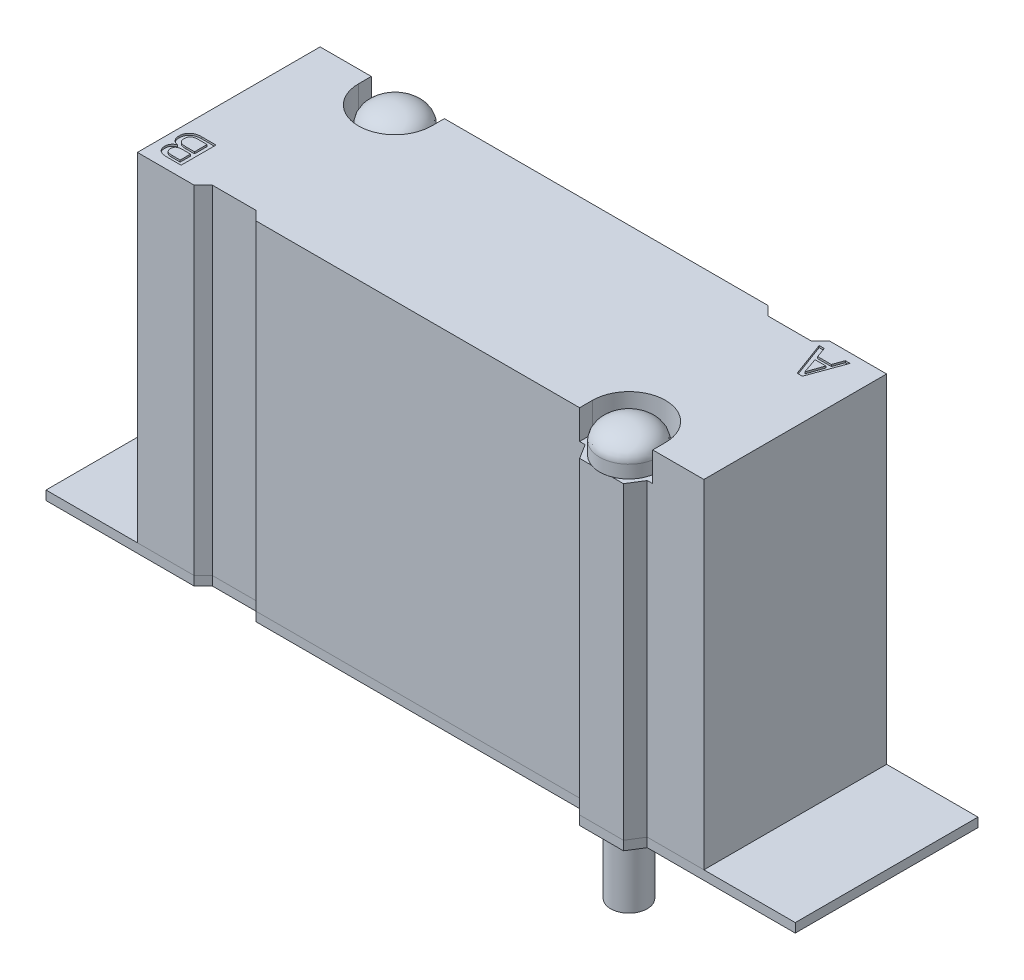
from build123d import *

# Parameters (mm, degrees)
BASE_SKETCH_W                 = 31
BASE_SKETCH_H                 = 11.6
VALVE_BASE_DEPTH              = 18.5
MOUNTING_SKETCH_R             = 1.1
MOUNTING_SCREW_HOLES_DEPTH    = 25.822167512
SIDE_CUTOUTS_DEPTH            = 25.822167512
CUT_EXTRUDE_A_DEPTH           = 0.1
CUT_EXTRUDE_B_DEPTH           = 0.1
SCREW_RELIEF_DEPTH            = 1.6
SCREW_HEAD_SKETCH_R           = 1.6
SCREW_HEAD_DEPTH              = 0.7
SCREW_HEAD_DOME_1_FACE_RADIUS = 1.6
SCREW_HEAD_DOME_1_HEIGHT      = 1
SCREW_HEAD_DOME_2_FACE_RADIUS = 1.6
SCREW_HEAD_DOME_2_HEIGHT      = 1
SCREW_THREADS_SKETCH_R        = 1
SCREW_THREADS_DEPTH           = 21
F_40_GASKET_SKETCH_R          = 1.1
F_40_GASKET_DEPTH             = 0.5


with BuildPart() as part:
    # Base Sketch → Valve base (new body)
    with BuildSketch(Plane(origin=(0, 0, 0), x_dir=(1, 0, 0), z_dir=(0, 1, 0))):
        Rectangle(BASE_SKETCH_W, BASE_SKETCH_H)
    extrude(amount=VALVE_BASE_DEPTH)

    # Mounting Sketch → Mounting Screw holes (cut, through all)
    with BuildSketch(Plane(origin=(0, 18.5, 0), x_dir=(-1, 0, 0), z_dir=(0, 1, 0))):
        with Locations((-10.7, 4.3)):
            Circle(MOUNTING_SKETCH_R)
        with Locations((10.7, -4.3)):
            Circle(MOUNTING_SKETCH_R)
    extrude(amount=-MOUNTING_SCREW_HOLES_DEPTH, mode=Mode.SUBTRACT)

    # side cut sketch → Side cutouts (cut, through all)
    with BuildSketch(Plane(origin=(0, 18.5, 0), x_dir=(-1, 0, 0), z_dir=(0, 1, 0))):
        Polygon((15.5, 5), (12.4, 5), (11.9, 4.5), (9.5, 4.5), (9, 5), (-9, 5), (-9.5, 5.8), (15.5, 5.8), align=None)
        Polygon((-11.9, 5.8), (-12.4, 5), (-15.5, 5), (-15.5, 5.8), align=None)
        Polygon((15.5, -5), (12.4, -5), (11.9, -5.8), (15.5, -5.8), align=None)
        Polygon((9.5, -5.8), (9, -5), (-9, -5), (-9.5, -4.5), (-11.9, -4.5), (-12.4, -5), (-15.5, -5), (-15.5, -5.8), align=None)
    extrude(amount=-SIDE_CUTOUTS_DEPTH, mode=Mode.SUBTRACT)

    # A Sketch → Cut-Extrude A (cut)
    with BuildSketch(Plane(origin=(0, 18.5, 0), x_dir=(-1, 0, 0), z_dir=(0, 1, 0))):
        Polygon((-14, -4.5), (-13.302127697, -2.587937137), (-13.016773764, -2.587937137), (-12.308559775, -4.5), (-12.588551352, -4.5), (-12.789639694, -3.936186592), (-13.538071352, -3.936186592), (-13.740691795, -4.5), align=None)
        Polygon((-13.45801904, -3.715563954), (-12.865861751, -3.715563954), (-13.160025269, -2.86409846), align=None, mode=Mode.SUBTRACT)
    extrude(amount=-CUT_EXTRUDE_A_DEPTH, mode=Mode.SUBTRACT)

    # B Sketch → Cut-Extrude B (cut)
    with BuildSketch(Plane(origin=(0, 18.5, 0), x_dir=(-1, 0, 0), z_dir=(0, 1, 0))):
        with BuildLine():
            Line((13.696109012, 2.5), (13.696109012, 4.412062863))
            Line((13.696109012, 4.412062863), (14.45449933, 4.412062863))
            add(Edge.make_bspline(
                [(14.45449933, 4.412062863), (14.478257852, 4.411688971), (14.524433142, 4.410962301), (14.591321129, 4.405553658), (14.653820092, 4.396962606), (14.711556909, 4.384359336), (14.764869843, 4.368460714), (14.813384507, 4.348348972), (14.857617281, 4.325229456), (14.897032572, 4.298168961), (14.931998423, 4.267779619), (14.961926966, 4.233278884), (14.987913656, 4.195700653), (15.00859288, 4.15422205), (15.024815372, 4.109370685), (15.036108382, 4.06090308), (15.043142564, 4.008943455), (15.043945593, 3.973139132), (15.044358466, 3.95473052)],
                knots=[0, 0, 0, 0, 1.338531614, 2.601470082, 3.778553788, 4.890456792, 5.928162005, 6.908738963, 7.84520586, 8.735147048, 9.596633689, 10.447968487, 11.301973765, 12.164180963, 13.051676454, 13.983434255, 14.963192844, 16, 16, 16, 16], degree=3))
            add(Edge.make_bspline(
                [(15.044358466, 3.95473052), (15.043453128, 3.931182499), (15.041696579, 3.88549433), (15.02874311, 3.81943049), (15.005850984, 3.759171327), (14.974543634, 3.704290685), (14.934165145, 3.655392946), (14.884583748, 3.613026669), (14.826645161, 3.576078243), (14.783324168, 3.557795778), (14.76091966, 3.548340556)],
                knots=[0, 0, 0, 0, 1.064089938, 2.064560856, 3.027045975, 3.965441717, 4.908263127, 5.877849772, 6.902478258, 8, 8, 8, 8], degree=3))
            add(Edge.make_bspline(
                [(14.76091966, 3.548340556), (14.775536857, 3.545402563), (14.804297843, 3.539621731), (14.845713362, 3.526727166), (14.884828242, 3.51152303), (14.921512767, 3.493568144), (14.955318682, 3.47224872), (14.986846804, 3.448563104), (15.01585291, 3.421881173), (15.042095036, 3.392380621), (15.066073253, 3.360709959), (15.086152481, 3.326449453), (15.103685874, 3.290549498), (15.11783739, 3.252432002), (15.128862246, 3.212171239), (15.136976428, 3.169929915), (15.141546807, 3.125710122), (15.142120645, 3.095614785), (15.142412972, 3.080283501)],
                knots=[0, 0, 0, 0, 1.079472139, 2.123983387, 3.137357801, 4.117691995, 5.07752268, 6.028353704, 6.970961659, 7.927265266, 8.885490285, 9.843581377, 10.799169054, 11.776706782, 12.784239396, 13.820032524, 14.889472473, 16, 16, 16, 16], degree=3))
            add(Edge.make_bspline(
                [(15.142412972, 3.080283501), (15.141980862, 3.058544612), (15.141138581, 3.016170572), (15.132163828, 2.954439411), (15.119238263, 2.896018184), (15.099837586, 2.841031835), (15.074777784, 2.789677413), (15.044848224, 2.741247391), (15.008885381, 2.69669958), (14.967904107, 2.65576764), (14.922300981, 2.618885875), (14.872256702, 2.58702628), (14.818235805, 2.560242438), (14.760653949, 2.537786365), (14.698817906, 2.521127273), (14.63323432, 2.509051166), (14.563731411, 2.501023848), (14.516061885, 2.500346722), (14.491652795, 2.5)],
                knots=[0, 0, 0, 0, 1.058427598, 2.063116183, 3.033417234, 3.969927738, 4.896405358, 5.812972495, 6.737861532, 7.679194237, 8.630321786, 9.589794139, 10.563499171, 11.563941868, 12.596215416, 13.678433312, 14.811246201, 16, 16, 16, 16], degree=3))
            Line((14.491652795, 2.5), (13.696109012, 2.5))
        make_face()
        with BuildLine():
            Line((13.965758903, 3.627626817), (14.401258797, 3.627626817))
            add(Edge.make_bspline(
                [(14.401258797, 3.627626817), (14.4167105, 3.627882087), (14.446623978, 3.628376273), (14.490028752, 3.631180774), (14.530289701, 3.637068538), (14.567395447, 3.644645892), (14.601449646, 3.653870957), (14.631871435, 3.666526162), (14.659642903, 3.680330492), (14.684077125, 3.697151785), (14.705689675, 3.715905827), (14.724440695, 3.737186773), (14.739596753, 3.761346258), (14.752935298, 3.7874564), (14.762770292, 3.816369594), (14.769522749, 3.847612765), (14.773836014, 3.88119858), (14.774410982, 3.904412728), (14.774708575, 3.916427978)],
                knots=[0, 0, 0, 0, 1.368886017, 2.65007316, 3.849640785, 4.969751217, 6.004381673, 6.968357812, 7.883879336, 8.746530739, 9.588092002, 10.41369514, 11.248159001, 12.107988605, 13.005734059, 13.944160956, 14.935932503, 16, 16, 16, 16], degree=3))
            add(Edge.make_bspline(
                [(14.774708575, 3.916427978), (14.774365013, 3.927799603), (14.773702887, 3.949715432), (14.770015709, 3.981585745), (14.763064505, 4.01108675), (14.753642898, 4.038420072), (14.7411212, 4.063294488), (14.726211444, 4.086036014), (14.708418737, 4.106498146), (14.687941733, 4.124646745), (14.664575078, 4.140448555), (14.638434372, 4.154338575), (14.609143216, 4.165574157), (14.577195917, 4.175336585), (14.5422697, 4.182314405), (14.504568738, 4.187804335), (14.463865084, 4.190719371), (14.435735067, 4.19119438), (14.421176119, 4.191440225)],
                knots=[0, 0, 0, 0, 1.064043854, 2.05066597, 2.995108535, 3.894129092, 4.74873584, 5.593437176, 6.431611697, 7.277662936, 8.145602371, 9.064553025, 10.040417484, 11.075719197, 12.186014413, 13.368359838, 14.637970495, 16, 16, 16, 16], degree=3))
            Line((14.421176119, 4.191440225), (13.965758903, 4.191440225))
            Line((13.965758903, 4.191440225), (13.965758903, 3.627626817))
        make_face(mode=Mode.SUBTRACT)
        with BuildLine():
            Line((13.965758903, 2.720622638), (14.469437321, 2.720622638))
            add(Edge.make_bspline(
                [(14.469437321, 2.720622638), (14.485535383, 2.720917677), (14.516640004, 2.721487751), (14.561798749, 2.725839449), (14.604000503, 2.732454325), (14.643180514, 2.742497536), (14.679549811, 2.755087486), (14.712861048, 2.770673575), (14.743053209, 2.789347324), (14.770551613, 2.810372914), (14.794619481, 2.834566767), (14.815584562, 2.861311147), (14.833263219, 2.890661087), (14.847862739, 2.922499214), (14.858953204, 2.956990744), (14.86689284, 2.993939419), (14.872042546, 3.033409922), (14.872518982, 3.060604908), (14.872763081, 3.07453812)],
                knots=[0, 0, 0, 0, 1.261340787, 2.437158505, 3.552412744, 4.605618057, 5.602418951, 6.564726798, 7.481099983, 8.379712099, 9.271165627, 10.147841252, 11.036708081, 11.950072001, 12.886651798, 13.869902527, 14.90865543, 16, 16, 16, 16], degree=3))
            add(Edge.make_bspline(
                [(14.872763081, 3.07453812), (14.872528231, 3.088345592), (14.872072093, 3.11516321), (14.866852376, 3.153979867), (14.859121902, 3.1901528), (14.847508303, 3.223263286), (14.832939865, 3.253616383), (14.814716207, 3.280902116), (14.793627219, 3.305758203), (14.768710027, 3.327365502), (14.740403211, 3.346137416), (14.708793141, 3.362814643), (14.673214268, 3.376356221), (14.634113921, 3.388075399), (14.590905202, 3.395988421), (14.544302015, 3.402686117), (14.493885398, 3.406472454), (14.459101523, 3.4068228), (14.44109344, 3.407004179)],
                knots=[0, 0, 0, 0, 1.058252033, 2.055394168, 2.998523969, 3.890395008, 4.739981298, 5.573732922, 6.40003374, 7.23274972, 8.093659094, 9.000297479, 9.967667442, 11.00874663, 12.12639854, 13.332554366, 14.619027337, 16, 16, 16, 16], degree=3))
            Line((14.44109344, 3.407004179), (13.965758903, 3.407004179))
            Line((13.965758903, 3.407004179), (13.965758903, 2.720622638))
        make_face(mode=Mode.SUBTRACT)
    extrude(amount=-CUT_EXTRUDE_B_DEPTH, mode=Mode.SUBTRACT)

    # Screw relief sketch → Screw relief (cut)
    with BuildSketch(Plane(origin=(0, 18.5, 0), x_dir=(-1, 0, 0), z_dir=(0, 1, 0))):
        with BuildLine():
            Line((8.7, -4.3), (8.7, -6.8))
            Line((8.7, -6.8), (12.7, -6.8))
            Line((12.7, -6.8), (12.7, -4.3))
            ThreePointArc((12.7, -4.3), (10.7, -2.3), (8.7, -4.3))
        make_face()
        with BuildLine():
            Line((-8.7, 4.3), (-8.7, 6.8))
            Line((-8.7, 6.8), (-12.7, 6.8))
            Line((-12.7, 6.8), (-12.7, 4.3))
            ThreePointArc((-12.7, 4.3), (-10.7, 2.3), (-8.7, 4.3))
        make_face()
    extrude(amount=-SCREW_RELIEF_DEPTH, mode=Mode.SUBTRACT)

    # Screw Head Sketch → Screw Head (add)
    with BuildSketch(Plane(origin=(0, 16.9, 0), x_dir=(-1, 0, 0), z_dir=(0, 1, 0))):
        with Locations((-10.7, 4.3)):
            Circle(SCREW_HEAD_SKETCH_R)
        with Locations((10.7, -4.3)):
            Circle(SCREW_HEAD_SKETCH_R)
    extrude(amount=SCREW_HEAD_DEPTH)

    # Screw Head Dome 1: an elliptical dome of height H over a round flat face of radius A is half a spheroid: the quarter ellipse of half axes A and H revolved about the face's axis
    with BuildSketch(Plane((-10.7, 17.6, -4.3), x_dir=(0, 0, -1), z_dir=(1, 0, 0)), mode=Mode.PRIVATE) as screw_head_dome_1_quarter:
        Ellipse(SCREW_HEAD_DOME_1_FACE_RADIUS, SCREW_HEAD_DOME_1_HEIGHT)
        Rectangle(SCREW_HEAD_DOME_1_FACE_RADIUS, SCREW_HEAD_DOME_1_HEIGHT, align=(Align.MIN, Align.MIN), mode=Mode.INTERSECT)
    revolve(screw_head_dome_1_quarter.sketch, axis=Axis((-10.7, 17.6, -4.3), (0, 1, 0)))

    # Screw Head Dome 2: an elliptical dome of height H over a round flat face of radius A is half a spheroid: the quarter ellipse of half axes A and H revolved about the face's axis
    with BuildSketch(Plane((10.7, 17.6, 4.3), x_dir=(0, 0, -1), z_dir=(1, 0, 0)), mode=Mode.PRIVATE) as screw_head_dome_2_quarter:
        Ellipse(SCREW_HEAD_DOME_2_FACE_RADIUS, SCREW_HEAD_DOME_2_HEIGHT)
        Rectangle(SCREW_HEAD_DOME_2_FACE_RADIUS, SCREW_HEAD_DOME_2_HEIGHT, align=(Align.MIN, Align.MIN), mode=Mode.INTERSECT)
    revolve(screw_head_dome_2_quarter.sketch, axis=Axis((10.7, 17.6, 4.3), (0, 1, 0)))

    # Screw Threads Sketch → Screw Threads (add)
    with BuildSketch(Plane.XZ.offset(-16.9)):
        with Locations((10.7, 4.3)):
            Circle(SCREW_THREADS_SKETCH_R)
        with Locations((-10.7, -4.3)):
            Circle(SCREW_THREADS_SKETCH_R)
    extrude(amount=SCREW_THREADS_DEPTH)


with BuildPart() as body_2:
    # 40 Gasket Sketch → 40 Gasket (new body)
    with BuildSketch(Plane.XZ):
        Polygon((20.5, 5), (20.5, -5), (12.4, -5), (11.9, -4.5), (9.5, -4.5), (9, -5), (-9, -5), (-9.5, -5.8), (-11.9, -5.8), (-12.4, -5), (-20.5, -5), (-20.5, 5), (-12.4, 5), (-11.9, 4.5), (-9.5, 4.5), (-9, 5), (9, 5), (9.5, 5.8), (11.9, 5.8), (12.4, 5), align=None)
        with Locations((10.7, 4.3)):
            Circle(F_40_GASKET_SKETCH_R, mode=Mode.SUBTRACT)
        with Locations((-10.7, -4.3)):
            Circle(F_40_GASKET_SKETCH_R, mode=Mode.SUBTRACT)
    extrude(amount=F_40_GASKET_DEPTH)


solid = Compound([part.part, body_2.part])
